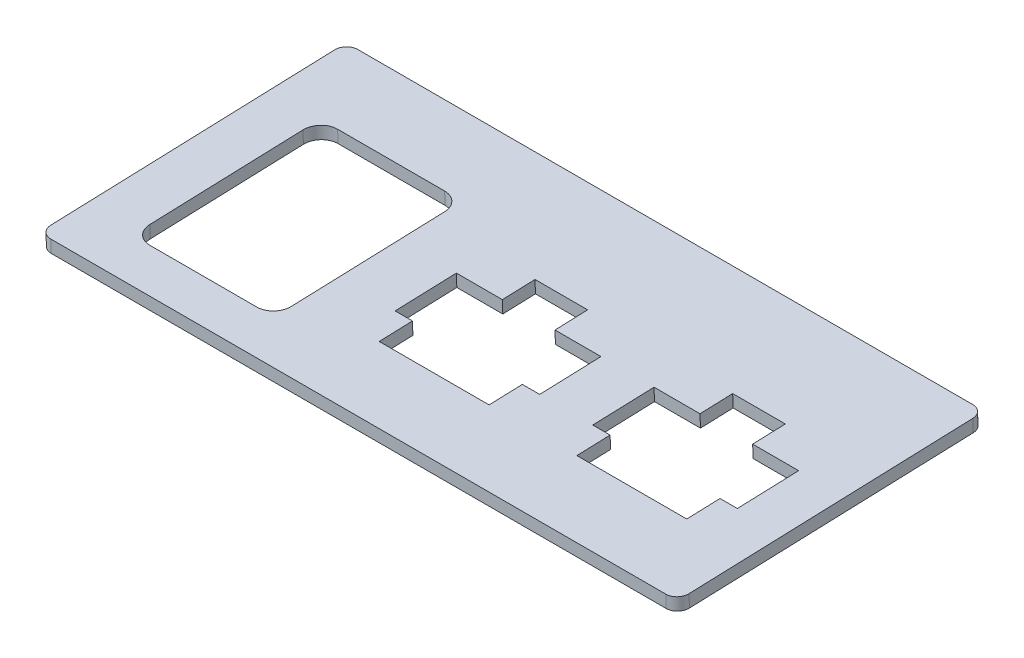
from build123d import *

# Parameters (mm, degrees)
SKETCH1_W           = 110.35
SKETCH1_H           = 53.101961072
BOSS_EXTRUDE1_DEPTH = 2.2
CUT_EXTRUDE1_REACH  = 75.803
FILLET1_R           = 2


with BuildPart() as part:
    # Sketch1 → Boss-Extrude1 (new body)
    with BuildSketch(Plane(origin=(0, -71.98718802, -2.513847999), x_dir=(1, 0, 0), z_dir=(0, 0.9993908270190958, 0.03489949670250105))):
        with Locations((0, 22.339385256)):
            Rectangle(SKETCH1_W, SKETCH1_H)
    extrude(amount=BOSS_EXTRUDE1_DEPTH)

    # Sketch2 → Cut-Extrude1 (cut, up to next)
    with BuildSketch(Plane(origin=(0, -71.98718802, -2.513847999), x_dir=(1, 0, 0), z_dir=(0, -0.9993908270190958, -0.03489949670250106)), mode=Mode.PRIVATE) as cut_extrude1_sk1:
        Polygon((-4.05, -24.762401314), (-4.05, -30.412401314), (5.05, -30.412401314), (5.05, -24.762401314), (13, -24.762401314), (13, -14.162401314), (10, -14.162401314), (10, -8.412401314), (-9, -8.412401314), (-9, -14.162401314), (-12, -14.162401314), (-12, -24.762401314), align=None)
    cut_extrude1_tool1 = extrude(cut_extrude1_sk1.sketch, amount=-CUT_EXTRUDE1_REACH, mode=Mode.PRIVATE) & part.part
    # Sketch2 → Cut-Extrude1 (cut, up to next)
    with BuildSketch(Plane(origin=(0, -71.98718802, -2.513847999), x_dir=(1, 0, 0), z_dir=(0, -0.9993908270190958, -0.03489949670250106)), mode=Mode.PRIVATE) as cut_extrude1_sk2:
        with BuildLine():
            Line((-43.425, -3.162401314), (-24.925, -3.162401314))
            ThreePointArc((-24.925, -3.162401314), (-22.803679656, -4.04108097), (-21.925, -6.162401314))
            Line((-21.925, -6.162401314), (-21.925, -32.662401314))
            ThreePointArc((-21.925, -32.662401314), (-22.803679656, -34.783721657), (-24.925, -35.662401314))
            Line((-24.925, -35.662401314), (-43.425, -35.662401314))
            ThreePointArc((-43.425, -35.662401314), (-45.546320344, -34.783721657), (-46.425, -32.662401314))
            Line((-46.425, -32.662401314), (-46.425, -6.162401314))
            ThreePointArc((-46.425, -6.162401314), (-45.546320344, -4.04108097), (-43.425, -3.162401314))
        make_face()
    cut_extrude1_tool2 = extrude(cut_extrude1_sk2.sketch, amount=-CUT_EXTRUDE1_REACH, mode=Mode.PRIVATE) & part.part
    # Sketch2 → Cut-Extrude1 (cut, up to next)
    with BuildSketch(Plane(origin=(0, -71.98718802, -2.513847999), x_dir=(1, 0, 0), z_dir=(0, -0.9993908270190958, -0.03489949670250106)), mode=Mode.PRIVATE) as cut_extrude1_sk3:
        Polygon((30.125, -24.762401314), (22.175, -24.762401314), (22.175, -14.162401314), (25.175, -14.162401314), (25.175, -8.412401314), (44.175, -8.412401314), (44.175, -14.162401314), (47.175, -14.162401314), (47.175, -24.762401314), (39.225, -24.762401314), (39.225, -30.412401314), (30.125, -30.412401314), align=None)
    cut_extrude1_tool3 = extrude(cut_extrude1_sk3.sketch, amount=-CUT_EXTRUDE1_REACH, mode=Mode.PRIVATE) & part.part
    add(cut_extrude1_tool1.solids().sort_by_distance((0.5, -71.346935, -20.848299))[0], mode=Mode.SUBTRACT)
    add(cut_extrude1_tool2.solids().sort_by_distance((-34.175, -71.309705, -21.914424))[0], mode=Mode.SUBTRACT)
    add(cut_extrude1_tool3.solids().sort_by_distance((34.675, -71.346935, -20.848299))[0], mode=Mode.SUBTRACT)

    # Fillet1
    fillet1_edges = [part.edges().sort_by_distance(p)[0] for p in [
        (-55.175, -71.034840666, 1.733571137),
        (55.175, -71.034840666, 1.733571137),
        (55.175, -69.181608951, -51.336041655),
        (-55.175, -69.181608951, -51.336041655),
    ]]
    fillet(fillet1_edges, radius=FILLET1_R)


solid = part.part
